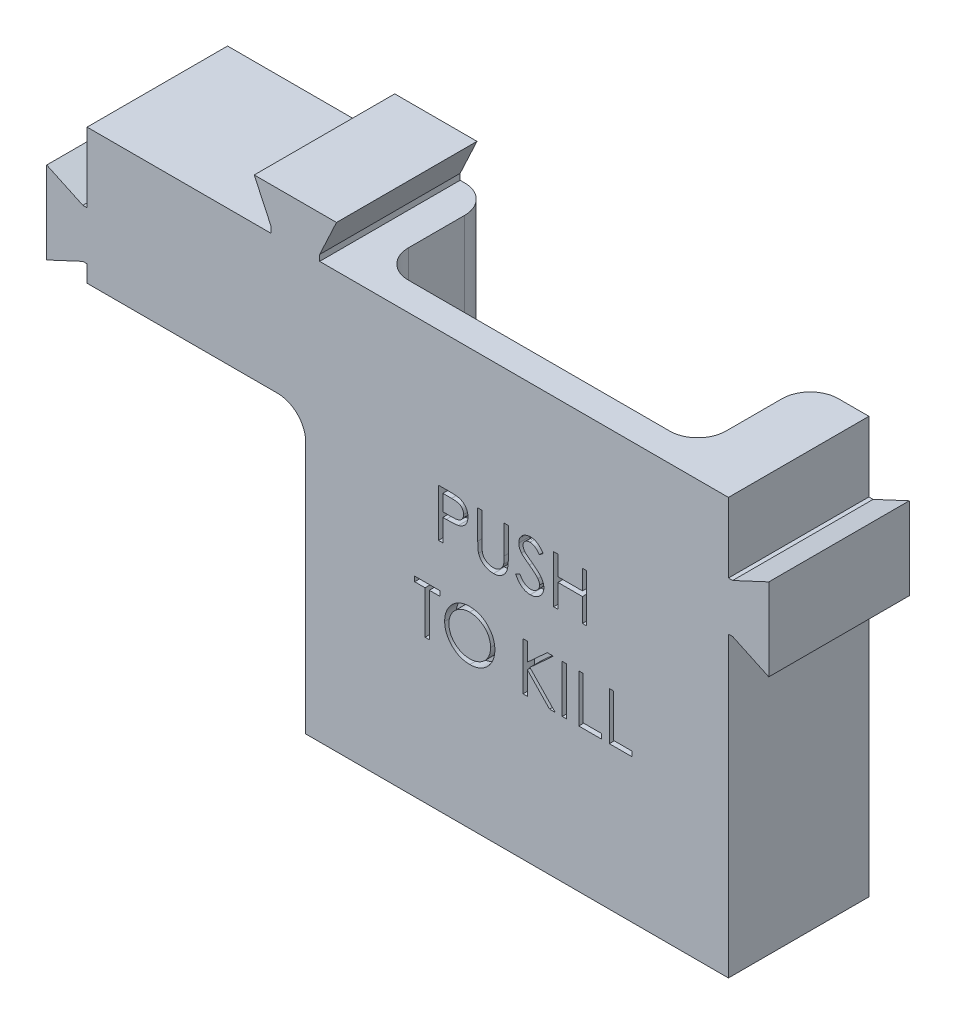
from build123d import *

# Parameters (mm, degrees)
BOSS_EXTRUDE1_DEPTH = 12.7
SKETCH2_W           = 28.702
SKETCH2_H           = 10.16
CUT_EXTRUDE1_DEPTH  = 69.772075122
FILLET1_R           = 2.54
BOSS_EXTRUDE2_DEPTH = 25.4
FILLET2_R           = 2.54
SKETCH4_W           = 0.387512821
SKETCH4_H           = 4.318
CUT_EXTRUDE2_DEPTH  = 1.016


with BuildPart() as part:
    # Sketch1 → Boss-Extrude1 (new body)
    with BuildSketch(Plane.XY):
        Polygon((4.029982442, 97.409), (20.665303267, 97.409), (20.665303267, 97.951017558), (19.141418027, 101.219), (26.578581973, 101.219), (25.054696733, 97.951017558), (25.054696733, 97.409), (62.010017558, 97.409), (62.010017558, 91.094696733), (62.391017558, 91.094696733), (65.659, 92.618581973), (65.659, 85.181418027), (62.391017558, 86.705303267), (62.010017558, 86.705303267), (62.010017558, 85.181418027), (4.029982442, 85.181418027), (4.029982442, 86.705303267), (3.648982442, 86.705303267), (0.381, 85.181418027), (0.381, 92.618581973), (3.648982442, 91.094696733), (4.029982442, 91.094696733), align=None)
    extrude(amount=BOSS_EXTRUDE1_DEPTH)

    # Sketch2 → Cut-Extrude1 (cut, through all)
    with BuildSketch(Plane.XZ.offset(-85.181418027)):
        with Locations((42.3545, 5.08)):
            Rectangle(SKETCH2_W, SKETCH2_H)
    extrude(amount=-CUT_EXTRUDE1_DEPTH, mode=Mode.SUBTRACT)

    # Fillet1
    fillet1_edges = [part.edges().sort_by_distance(p)[0] for p in [
        (56.7055, 91.295209014, 0),
        (28.0035, 91.295209014, 0),
        (28.0035, 91.295209014, 10.16),
        (56.7055, 91.295209014, 10.16),
    ]]
    fillet(fillet1_edges, radius=FILLET1_R)

    # Sketch3 → Boss-Extrude2 (add)
    with BuildSketch(Plane.XZ.offset(-85.181418027)):
        with BuildLine():
            Line((23.793902063, 12.7), (23.793902063, 0))
            Line((23.793902063, 0), (25.4635, 0))
            ThreePointArc((25.4635, 0), (27.259551224, 0.743948776), (28.0035, 2.54))
            Line((28.0035, 2.54), (28.0035, 7.62))
            ThreePointArc((28.0035, 7.62), (28.747448776, 9.416051224), (30.5435, 10.16))
            Line((30.5435, 10.16), (54.1655, 10.16))
            ThreePointArc((54.1655, 10.16), (55.961551224, 9.416051224), (56.7055, 7.62))
            Line((56.7055, 7.62), (56.7055, 2.54))
            ThreePointArc((56.7055, 2.54), (57.449448776, 0.743948776), (59.2455, 0))
            Line((59.2455, 0), (62.010017558, 0))
            Line((62.010017558, 0), (62.010017558, 12.7))
            Line((62.010017558, 12.7), (23.793902063, 12.7))
        make_face()
    extrude(amount=BOSS_EXTRUDE2_DEPTH)

    # Fillet2
    fillet2_edges = [part.edges().sort_by_distance(p)[0] for p in [
        (23.793902063, 85.181418027, 6.35),
    ]]
    fillet(fillet2_edges, radius=FILLET2_R)

    # Sketch4 → Cut-Extrude2 (cut)
    # profile 1 of 10: a face of its own
    with BuildSketch(Plane.XY.offset(12.7)):
        with BuildLine():
            Line((35.803091039, 85.260556175), (36.64991035, 85.260556175))
            add(Edge.make_bspline(
                [(36.64991035, 85.260556175), (36.708155119, 85.26049215), (36.819754684, 85.260369475), (36.979786001, 85.25665014), (37.12512955, 85.251682352), (37.255471934, 85.244795891), (37.371214195, 85.236657583), (37.4718326, 85.22524321), (37.55811803, 85.213325166), (37.609818615, 85.201208356), (37.633397129, 85.195682377)],
                knots=[0, 0, 0, 0, 1.415646017, 2.712440637, 3.8905458, 4.950247383, 5.884950622, 6.709939814, 7.411656543, 8, 8, 8, 8], degree=3))
            add(Edge.make_bspline(
                [(37.633397129, 85.195682377), (37.663245037, 85.187512783), (37.722237525, 85.171366101), (37.807241726, 85.139025856), (37.888116442, 85.100679345), (37.965139147, 85.056976324), (38.037363351, 85.006041734), (38.105866621, 84.949940282), (38.170044414, 84.887376695), (38.229535834, 84.819052685), (38.284170622, 84.746115238), (38.331211756, 84.667475538), (38.370600832, 84.584457296), (38.404383965, 84.497118256), (38.428698567, 84.404724994), (38.447015399, 84.30791949), (38.458641463, 84.20671212), (38.459754967, 84.137550261), (38.460321808, 84.102342633)],
                knots=[0, 0, 0, 0, 0.999701418, 1.975846123, 2.934577507, 3.890451536, 4.834027766, 5.787354733, 6.749476667, 7.726910423, 8.712836071, 9.690891519, 10.682875813, 11.679750201, 12.712814741, 13.765529915, 14.8625177, 16, 16, 16, 16], degree=3))
            add(Edge.make_bspline(
                [(38.460321808, 84.102342633), (38.45980189, 84.066839079), (38.458784636, 83.997373977), (38.446575448, 83.895749491), (38.4301298, 83.798633489), (38.404842294, 83.706241304), (38.371722403, 83.619121619), (38.332870208, 83.535943082), (38.286009384, 83.45812079), (38.232164134, 83.385372215), (38.172265338, 83.317629071), (38.106566428, 83.255382271), (38.035332638, 83.198996175), (37.958790353, 83.148344378), (37.876193368, 83.104601459), (37.788794391, 83.065422018), (37.695833753, 83.03251755), (37.631504789, 83.015208463), (37.59879777, 83.006407938)],
                knots=[0, 0, 0, 0, 1.121902311, 2.195077645, 3.232258892, 4.234102512, 5.217864754, 6.176164875, 7.132989551, 8.084763148, 9.034132444, 9.988522005, 10.94243251, 11.903244335, 12.886203696, 13.894208494, 14.929344452, 16, 16, 16, 16], degree=3))
            add(Edge.make_bspline(
                [(37.59879777, 83.006407938), (37.571745705, 83.000655151), (37.512459531, 82.988047586), (37.414820024, 82.973972809), (37.301138945, 82.961959392), (37.171571458, 82.952951875), (37.026233864, 82.945240706), (36.865047541, 82.939111497), (36.687696082, 82.935743638), (36.563990016, 82.93556994), (36.499403138, 82.935479252)],
                knots=[0, 0, 0, 0, 0.601384939, 1.31797006, 2.144135048, 3.087295005, 4.142315834, 5.309527816, 6.595305764, 8, 8, 8, 8], degree=3))
            Line((36.499403138, 82.935479252), (36.190603859, 82.935479252))
            Line((36.190603859, 82.935479252), (36.190603859, 80.942556175))
            Line((36.190603859, 80.942556175), (35.803091039, 80.942556175))
            Line((35.803091039, 80.942556175), (35.803091039, 85.260556175))
        make_face()
        with BuildLine():
            Line((36.190603859, 84.81768438), (36.190603859, 83.378351047))
            Line((36.190603859, 83.378351047), (36.946599853, 83.368836223))
            add(Edge.make_bspline(
                [(36.946599853, 83.368836223), (36.983512493, 83.368817145), (37.054771583, 83.368780316), (37.157708044, 83.373696944), (37.253208987, 83.379372686), (37.340981066, 83.387682891), (37.421063847, 83.399429403), (37.493590861, 83.411287541), (37.557999732, 83.428442786), (37.63337869, 83.451541704), (37.717374089, 83.490937428), (37.808752281, 83.548119949), (37.88619325, 83.621008663), (37.953206509, 83.702961627), (38.006386847, 83.794132039), (38.045317925, 83.891680516), (38.068192416, 83.994606646), (38.071259668, 84.065037098), (38.072808988, 84.100612665)],
                knots=[0, 0, 0, 0, 1.160613943, 2.240541288, 3.23993089, 4.169200891, 5.011653406, 5.7853311, 6.478053781, 7.106038997, 8.262395093, 9.384106736, 10.481365981, 11.59014053, 12.70357646, 13.786202915, 14.881775077, 16, 16, 16, 16], degree=3))
            add(Edge.make_bspline(
                [(38.072808988, 84.100612665), (38.071251243, 84.135327551), (38.068154638, 84.204336448), (38.045138633, 84.305474816), (38.006462537, 84.401995323), (37.952849516, 84.49202326), (37.88778203, 84.573681333), (37.812156155, 84.64461636), (37.726149908, 84.701640735), (37.646145719, 84.738446481), (37.575082313, 84.760918927), (37.51335717, 84.776642418), (37.443663818, 84.789196209), (37.365979568, 84.799361402), (37.280906537, 84.808063357), (37.187713839, 84.813967886), (37.086754504, 84.817424082), (37.016666492, 84.817595514), (36.980334228, 84.81768438)],
                knots=[0, 0, 0, 0, 1.120700087, 2.227813068, 3.331159281, 4.466773991, 5.599788987, 6.693661531, 7.80175334, 8.91857717, 9.525282508, 10.207424825, 10.974604443, 11.810962634, 12.737642355, 13.736264703, 14.826523623, 16, 16, 16, 16], degree=3))
            Line((36.980334228, 84.81768438), (36.190603859, 84.81768438))
        make_face(mode=Mode.SUBTRACT)
    # profile 2 of 10: a face of its own
    with BuildSketch(Plane.XY.offset(12.7)):
        with BuildLine():
            Line((39.346065398, 85.260556175), (39.733578218, 85.260556175))
            Line((39.733578218, 85.260556175), (39.733578218, 82.673389108))
            add(Edge.make_bspline(
                [(39.733578218, 82.673389108), (39.73352055, 82.63677156), (39.733411113, 82.567283453), (39.734142106, 82.468378675), (39.736189293, 82.380448824), (39.737479955, 82.303154962), (39.740351219, 82.236851767), (39.742692867, 82.181180026), (39.745703817, 82.13640335), (39.749322446, 82.110272139), (39.750877898, 82.099039749)],
                knots=[0, 0, 0, 0, 1.528628734, 2.90083645, 4.128790002, 5.200304208, 6.127813768, 6.898992206, 7.526736466, 8, 8, 8, 8], degree=3))
            add(Edge.make_bspline(
                [(39.750877898, 82.099039749), (39.757265403, 82.058516228), (39.7696805, 81.979752541), (39.801320802, 81.867597695), (39.845509365, 81.766517684), (39.897871953, 81.673358325), (39.966876815, 81.590712595), (40.049540033, 81.514578047), (40.149690206, 81.447992261), (40.261046005, 81.387107459), (40.381068192, 81.338172081), (40.503713291, 81.301168839), (40.627137744, 81.278617899), (40.709767196, 81.276006694), (40.750799372, 81.274710021)],
                knots=[0, 0, 0, 0, 1.035780045, 2.013197591, 2.933192213, 3.817615948, 4.702609284, 5.640816605, 6.646850145, 7.73207398, 8.84249596, 9.914020372, 10.964143139, 12, 12, 12, 12], degree=3))
            add(Edge.make_bspline(
                [(40.750799372, 81.274710021), (40.78602653, 81.276034846), (40.856277382, 81.278676843), (40.960657544, 81.29503766), (41.062315735, 81.324524129), (41.161753945, 81.362571579), (41.254962274, 81.412842465), (41.341992726, 81.470914432), (41.419672232, 81.539028878), (41.490558984, 81.614409246), (41.552287799, 81.699461262), (41.605795396, 81.792332976), (41.649624243, 81.894422028), (41.671267941, 81.966167969), (41.682387113, 82.003026528)],
                knots=[0, 0, 0, 0, 0.994687771, 1.983630487, 2.973142513, 3.978332533, 4.983357753, 5.956394766, 6.925816176, 7.893390482, 8.871859704, 9.88551698, 10.913711441, 12, 12, 12, 12], degree=3))
            add(Edge.make_bspline(
                [(41.682387113, 82.003026528), (41.68608841, 82.01826114), (41.694336392, 82.052209996), (41.702043461, 82.109603977), (41.710070654, 82.17732177), (41.715640344, 82.25584992), (41.721070192, 82.344925292), (41.724318652, 82.445011915), (41.725820123, 82.555746359), (41.726267567, 82.633022721), (41.726501295, 82.673389108)],
                knots=[0, 0, 0, 0, 0.558680831, 1.244966039, 2.062412453, 2.990489873, 4.051219941, 5.244515665, 6.560634259, 8, 8, 8, 8], degree=3))
            Line((41.726501295, 82.673389108), (41.726501295, 85.260556175))
            Line((41.726501295, 85.260556175), (42.114014116, 85.260556175))
            Line((42.114014116, 85.260556175), (42.114014116, 82.652629492))
            add(Edge.make_bspline(
                [(42.114014116, 82.652629492), (42.113700604, 82.605626978), (42.113088766, 82.513898713), (42.107783084, 82.379483865), (42.099323505, 82.251975816), (42.087371172, 82.131357425), (42.071533978, 82.018060311), (42.053922435, 81.9110914), (42.031494085, 81.811218536), (42.005298135, 81.717662999), (41.975351512, 81.6286067), (41.936562118, 81.544086643), (41.892858406, 81.461533393), (41.841024329, 81.38219556), (41.782778972, 81.305721864), (41.716834869, 81.232576085), (41.645373005, 81.161589342), (41.567205411, 81.094582536), (41.48362062, 81.03313286), (41.394867266, 80.979098924), (41.301627126, 80.933422358), (41.204142569, 80.895823775), (41.102371993, 80.867553707), (40.996312833, 80.846487843), (40.88572368, 80.83451798), (40.810510713, 80.83273905), (40.772423972, 80.831838226)],
                knots=[0, 0, 0, 0, 1.316592851, 2.569410997, 3.76748051, 4.895814652, 5.963796859, 6.97159953, 7.931736103, 8.829262218, 9.692595152, 10.560224239, 11.431080259, 12.30701507, 13.211635791, 14.121146779, 15.063487852, 16.031507147, 17.00238618, 17.966455255, 18.938106653, 19.907068911, 20.888905087, 21.893141452, 22.933117798, 24, 24, 24, 24], degree=3))
            add(Edge.make_bspline(
                [(40.772423972, 80.831838226), (40.730885919, 80.832806402), (40.649388408, 80.83470596), (40.529301043, 80.845590713), (40.414177986, 80.866093064), (40.302803347, 80.892198389), (40.196693436, 80.928202782), (40.094426609, 80.970270126), (39.997754385, 81.0219347), (39.905108452, 81.079417635), (39.818964653, 81.14409466), (39.739886771, 81.214589309), (39.667744254, 81.289772323), (39.603753102, 81.370457689), (39.546853108, 81.45601788), (39.497837376, 81.546694942), (39.45575138, 81.642453768), (39.434029906, 81.709016602), (39.423048972, 81.742666351)],
                knots=[0, 0, 0, 0, 1.13879206, 2.234305948, 3.301075583, 4.341971843, 5.366689343, 6.369221514, 7.369726634, 8.367512178, 9.355451585, 10.318319045, 11.268648973, 12.207971039, 13.137398894, 14.081662264, 15.030215811, 16, 16, 16, 16], degree=3))
            add(Edge.make_bspline(
                [(39.423048972, 81.742666351), (39.416661838, 81.765653625), (39.402808002, 81.815513532), (39.38797222, 81.898032349), (39.375500502, 81.993046753), (39.363773359, 82.100563248), (39.356853507, 82.220665169), (39.350786793, 82.353300455), (39.346022659, 82.498629483), (39.346050753, 82.599861311), (39.346065398, 82.652629492)],
                knots=[0, 0, 0, 0, 0.625038921, 1.35572334, 2.194682327, 3.136881307, 4.189498639, 5.346923369, 6.617055217, 8, 8, 8, 8], degree=3))
            Line((39.346065398, 82.652629492), (39.346065398, 85.260556175))
        make_face()
    # profile 3 of 10: a face of its own
    with BuildSketch(Plane.XY.offset(12.7)):
        with BuildLine():
            Line((42.778321808, 81.775535742), (43.143345045, 81.994376688))
            add(Edge.make_bspline(
                [(43.143345045, 81.994376688), (43.177294688, 81.937546398), (43.242340892, 81.828661756), (43.350847741, 81.681531408), (43.463279715, 81.556479467), (43.580469413, 81.454233412), (43.701701517, 81.373734929), (43.827767444, 81.316734575), (43.958242366, 81.281183895), (44.047037497, 81.276865788), (44.091367481, 81.274710021)],
                knots=[0, 0, 0, 0, 1.272034388, 2.437168799, 3.508375237, 4.49857839, 5.41946034, 6.295179144, 7.148887113, 8, 8, 8, 8], degree=3))
            add(Edge.make_bspline(
                [(44.091367481, 81.274710021), (44.129226299, 81.275764443), (44.204281495, 81.277854836), (44.314775714, 81.297940694), (44.422086406, 81.328798515), (44.524001863, 81.37299131), (44.619115824, 81.426458619), (44.702523169, 81.491038846), (44.774628974, 81.563342159), (44.833611762, 81.644005674), (44.878864445, 81.730756945), (44.913645403, 81.819801447), (44.932946954, 81.912537984), (44.935854514, 81.974976835), (44.937321808, 82.006486463)],
                knots=[0, 0, 0, 0, 1.095163259, 2.171163733, 3.241058638, 4.321873601, 5.38011039, 6.391990106, 7.366004449, 8.327778327, 9.272591725, 10.192022065, 11.087607919, 12, 12, 12, 12], degree=3))
            add(Edge.make_bspline(
                [(44.937321808, 82.006486463), (44.93550293, 82.042437946), (44.931805416, 82.115522057), (44.900553608, 82.223348257), (44.851391023, 82.330055376), (44.806036424, 82.396060652), (44.782489677, 82.430328611)],
                knots=[0, 0, 0, 0, 0.938893495, 1.908633276, 2.914225137, 4, 4, 4, 4], degree=3))
            add(Edge.make_bspline(
                [(44.782489677, 82.430328611), (44.763156616, 82.455060664), (44.722569274, 82.506982514), (44.652793463, 82.584268836), (44.570916639, 82.663989503), (44.479740768, 82.749188648), (44.375944574, 82.835903707), (44.262779029, 82.928269771), (44.137354874, 83.022774231), (44.049391667, 83.086153299), (44.0040041, 83.118855854)],
                knots=[0, 0, 0, 0, 0.722233717, 1.516239348, 2.393582979, 3.351407094, 4.387010283, 5.505090956, 6.712668013, 8, 8, 8, 8], degree=3))
            add(Edge.make_bspline(
                [(44.0040041, 83.118855854), (43.95857381, 83.151214438), (43.871714554, 83.213081585), (43.750244795, 83.304899887), (43.641623083, 83.388846581), (43.546332205, 83.465711931), (43.464414074, 83.535506362), (43.395223168, 83.597559648), (43.340522057, 83.653549995), (43.310104115, 83.689872199), (43.296447209, 83.706179973)],
                knots=[0, 0, 0, 0, 1.452282411, 2.77665338, 3.964542531, 5.026858415, 5.96415736, 6.766646006, 7.446254459, 8, 8, 8, 8], degree=3))
            add(Edge.make_bspline(
                [(43.296447209, 83.706179973), (43.277358509, 83.731595767), (43.239818018, 83.781579335), (43.190264643, 83.859704117), (43.148146671, 83.939677506), (43.115129599, 84.021714404), (43.087326344, 84.104663096), (43.068625788, 84.189605861), (43.056916116, 84.276161551), (43.055716963, 84.334409521), (43.05511668, 84.363567794)],
                knots=[0, 0, 0, 0, 1.068054152, 2.10047183, 3.106115577, 4.101338837, 5.06977816, 6.043150881, 7.020423561, 8, 8, 8, 8], degree=3))
            add(Edge.make_bspline(
                [(43.05511668, 84.363567794), (43.056726935, 84.409251955), (43.059913027, 84.499643812), (43.086857985, 84.631689277), (43.129387686, 84.75775812), (43.188969779, 84.876602228), (43.265777565, 84.985127116), (43.354661713, 85.084581126), (43.460528569, 85.168188194), (43.576686006, 85.241238957), (43.703828124, 85.298416587), (43.837058044, 85.341548447), (43.976587518, 85.365987412), (44.071093899, 85.369494571), (44.119046968, 85.371274124)],
                knots=[0, 0, 0, 0, 1.005424448, 1.989358655, 2.955360095, 3.929531133, 4.905563448, 5.876582895, 6.856512386, 7.866279853, 8.892233794, 9.918561126, 10.94386622, 12, 12, 12, 12], degree=3))
            add(Edge.make_bspline(
                [(44.119046968, 85.371274124), (44.169930404, 85.369519101), (44.271121318, 85.366028922), (44.419967978, 85.335682597), (44.563277114, 85.285469596), (44.678559404, 85.228485989), (44.768784337, 85.171573003), (44.837591954, 85.119732545), (44.90731834, 85.060051483), (44.978525929, 84.992370847), (45.050008148, 84.916069627), (45.122826225, 84.831670382), (45.19715044, 84.739688894), (45.244964098, 84.674025067), (45.269475654, 84.640362665)],
                knots=[0, 0, 0, 0, 1.286793592, 2.559021753, 3.825965368, 5.121522368, 5.803751409, 6.523245864, 7.299691795, 8.125521123, 9.008227632, 9.944561021, 10.946284179, 12, 12, 12, 12], degree=3))
            Line((45.269475654, 84.640362665), (44.919157145, 84.374812585))
            add(Edge.make_bspline(
                [(44.919157145, 84.374812585), (44.898003963, 84.402063718), (44.85726788, 84.454543029), (44.795422416, 84.528037012), (44.737131084, 84.5951714), (44.679701191, 84.653483064), (44.626165848, 84.706165295), (44.574205452, 84.75126959), (44.524567758, 84.789237882), (44.46199758, 84.829757451), (44.383388121, 84.869922874), (44.284710056, 84.903910565), (44.181588474, 84.924334782), (44.111353575, 84.927035244), (44.07579777, 84.928402329)],
                knots=[0, 0, 0, 0, 1.181633172, 2.275549214, 3.290209073, 4.226197932, 5.078386478, 5.862611352, 6.581680152, 7.217281963, 8.414376989, 9.595101626, 10.782541182, 12, 12, 12, 12], degree=3))
            add(Edge.make_bspline(
                [(44.07579777, 84.928402329), (44.031190951, 84.926907437), (43.945170905, 84.92402468), (43.823045236, 84.892540309), (43.713128788, 84.842967374), (43.618684795, 84.773490781), (43.540051576, 84.691176139), (43.483170613, 84.596452969), (43.448934838, 84.491855708), (43.444757137, 84.418891802), (43.4426295, 84.381732457)],
                knots=[0, 0, 0, 0, 1.14458467, 2.207223713, 3.21896685, 4.227309161, 5.202851033, 6.127160689, 7.046193047, 8, 8, 8, 8], degree=3))
            add(Edge.make_bspline(
                [(43.4426295, 84.381732457), (43.443114506, 84.35859849), (43.444085311, 84.312292728), (43.457625076, 84.243881516), (43.47501962, 84.175643127), (43.502584044, 84.107884352), (43.540638335, 84.039420168), (43.590610149, 83.969071636), (43.653546001, 83.896218699), (43.70175587, 83.848834973), (43.727209228, 83.823817794)],
                knots=[0, 0, 0, 0, 0.858281714, 1.717966888, 2.583508476, 3.4729293, 4.427298488, 5.488583878, 6.674047936, 8, 8, 8, 8], degree=3))
            add(Edge.make_bspline(
                [(43.727209228, 83.823817794), (43.736661173, 83.815382857), (43.759116829, 83.795343379), (43.800169814, 83.762536102), (43.854382672, 83.722066854), (43.920339754, 83.671993702), (43.999257202, 83.613908629), (44.091143694, 83.548554327), (44.194974979, 83.473809181), (44.26865476, 83.421552078), (44.307613475, 83.393920758)],
                knots=[0, 0, 0, 0, 0.420754252, 0.999615792, 1.744751191, 2.668019286, 3.750313428, 4.999500688, 6.413464383, 8, 8, 8, 8], degree=3))
            add(Edge.make_bspline(
                [(44.307613475, 83.393920758), (44.354477239, 83.359819218), (44.445222422, 83.293786312), (44.574339974, 83.194576339), (44.69141182, 83.097547463), (44.796848996, 83.003319318), (44.891693136, 82.912606659), (44.974892015, 82.824318142), (45.047293377, 82.739086284), (45.125238482, 82.629813032), (45.204884386, 82.495608254), (45.273283366, 82.331180987), (45.316411978, 82.166114555), (45.322051922, 82.055170532), (45.324834629, 82.000431576)],
                knots=[0, 0, 0, 0, 1.163667725, 2.253281268, 3.268753668, 4.215851969, 5.092017293, 5.902905408, 6.650798638, 7.335211899, 8.59617414, 9.77448103, 10.901945474, 12, 12, 12, 12], degree=3))
            add(Edge.make_bspline(
                [(45.324834629, 82.000431576), (45.324023908, 81.961719638), (45.32241821, 81.885047523), (45.303960717, 81.772464831), (45.276918113, 81.663119661), (45.236159606, 81.558363609), (45.186412349, 81.456280213), (45.123287818, 81.359547266), (45.05011908, 81.266023829), (44.966184853, 81.178203739), (44.87433988, 81.097585204), (44.777266681, 81.02587055), (44.674806373, 80.966074487), (44.567514786, 80.917280048), (44.455367275, 80.879116926), (44.338401557, 80.851465849), (44.216424829, 80.834495232), (44.133518635, 80.832733782), (44.091367481, 80.831838226)],
                knots=[0, 0, 0, 0, 0.983748083, 1.948392443, 2.894712957, 3.844097841, 4.80183111, 5.778335162, 6.776009319, 7.81870978, 8.863265674, 9.881300176, 10.883814829, 11.87499822, 12.874611388, 13.892143829, 14.928324115, 16, 16, 16, 16], degree=3))
            add(Edge.make_bspline(
                [(44.091367481, 80.831838226), (44.058753821, 80.832468878), (43.993937236, 80.83372224), (43.898065938, 80.844802574), (43.804131439, 80.860479509), (43.713312448, 80.885368548), (43.624438864, 80.915566144), (43.537897218, 80.952748235), (43.45364557, 80.997306543), (43.371211763, 81.048252804), (43.290805453, 81.10754233), (43.213180807, 81.176597633), (43.135790914, 81.253514173), (43.060920006, 81.340380691), (42.987053653, 81.435793788), (42.915648232, 81.540646158), (42.845225702, 81.654366676), (42.801039647, 81.734391659), (42.778321808, 81.775535742)],
                knots=[0, 0, 0, 0, 0.915332311, 1.819136955, 2.706846663, 3.586547465, 4.459518054, 5.340707479, 6.227863349, 7.133153174, 8.059268498, 9.028702269, 10.047606654, 11.120612155, 12.245963614, 13.433783089, 14.680604001, 16, 16, 16, 16], degree=3))
        make_face()
    # profile 4 of 10: a face of its own
    with BuildSketch(Plane.XY.offset(12.7)):
        Polygon((46.210578218, 85.260556175), (46.598091039, 85.260556175), (46.598091039, 83.489068996), (48.812450013, 83.489068996), (48.812450013, 85.260556175), (49.199962834, 85.260556175), (49.199962834, 80.942556175), (48.812450013, 80.942556175), (48.812450013, 83.046197201), (46.598091039, 83.046197201), (46.598091039, 80.942556175), (46.210578218, 80.942556175), align=None)
    # profile 5 of 10: a face of its own
    with BuildSketch(Plane.XY.offset(12.7)):
        Polygon((33.644091039, 76.621017713), (33.644091039, 77.063889508), (35.913808988, 77.063889508), (35.913808988, 76.621017713), (34.972706424, 76.621017713), (34.972706424, 72.745889508), (34.585193603, 72.745889508), (34.585193603, 76.621017713), align=None)
    # profile 6 of 10: a face of its own
    with BuildSketch(Plane.XY.offset(12.7)):
        with BuildLine():
            add(Edge.make_bspline(
                [(38.598719244, 77.174607457), (38.67867393, 77.17258234), (38.83571153, 77.168604845), (39.066508504, 77.138157882), (39.286843824, 77.085483969), (39.498512356, 77.015331296), (39.698982262, 76.921748657), (39.889762473, 76.808635379), (40.070399062, 76.674806423), (40.238457326, 76.521296308), (40.392248387, 76.354271807), (40.527742152, 76.176027345), (40.641296044, 75.987640651), (40.73454731, 75.789677832), (40.807704852, 75.582586592), (40.85818726, 75.365262882), (40.89043427, 75.1391148), (40.894204226, 74.984867371), (40.89611668, 74.906619476)],
                knots=[0, 0, 0, 0, 1.065120563, 2.091984664, 3.0946048, 4.079830382, 5.057816894, 6.036188127, 7.030412546, 8.04752943, 9.064399622, 10.05169764, 11.02544977, 11.989514704, 12.962713494, 13.945757189, 14.957906945, 16, 16, 16, 16], degree=3))
            add(Edge.make_bspline(
                [(40.89611668, 74.906619476), (40.894204506, 74.828947975), (40.89043539, 74.675848449), (40.858150595, 74.45113548), (40.807517727, 74.235123586), (40.735226676, 74.028173378), (40.642419929, 73.830066543), (40.528109921, 73.641324353), (40.39346085, 73.46188493), (40.240225083, 73.293714048), (40.073178884, 73.139502882), (39.894006229, 73.005128109), (39.706736641, 72.889499318), (39.508960264, 72.797237631), (39.303300047, 72.723496159), (39.087915341, 72.673219057), (38.863815393, 72.640788356), (38.710993966, 72.63706437), (38.633318603, 72.63517156)],
                knots=[0, 0, 0, 0, 1.043624062, 2.057103931, 3.04512605, 4.022047818, 4.998200453, 5.980619268, 6.982898556, 8.009068085, 9.034988726, 10.034168286, 11.015286542, 11.987931943, 12.962482838, 13.94673481, 14.956375938, 16, 16, 16, 16], degree=3))
            add(Edge.make_bspline(
                [(38.633318603, 72.63517156), (38.555071115, 72.63708306), (38.400824486, 72.640851137), (38.174392223, 72.67315151), (37.956915853, 72.723661382), (37.74901729, 72.795845309), (37.550580603, 72.889135367), (37.361217695, 73.002889226), (37.181688644, 73.137866379), (37.013481884, 73.291052456), (36.859577016, 73.457815531), (36.72539902, 73.63649962), (36.611619581, 73.823599124), (36.518642761, 74.019633269), (36.445033865, 74.223654381), (36.394815749, 74.437023388), (36.362324709, 74.658523841), (36.358580575, 74.809336651), (36.356680783, 74.885859861)],
                knots=[0, 0, 0, 0, 1.053102029, 2.075944431, 3.073151272, 4.055350789, 5.033113405, 6.020478099, 7.024410459, 8.052272461, 9.079885166, 10.07527673, 11.055994387, 12.023226415, 12.992069828, 13.970394897, 14.97016774, 16, 16, 16, 16], degree=3))
            add(Edge.make_bspline(
                [(36.356680783, 74.885859861), (36.35734037, 74.93722268), (36.358651224, 75.039300352), (36.374432518, 75.190882632), (36.397332354, 75.340027163), (36.430151513, 75.486309836), (36.47307449, 75.629372559), (36.523720962, 75.770201986), (36.585579206, 75.907370934), (36.655506931, 76.04152921), (36.733553927, 76.170585478), (36.819760638, 76.292574632), (36.911099129, 76.40852033), (37.011231568, 76.515417977), (37.116857799, 76.616377328), (37.229691307, 76.709846874), (37.349043596, 76.796669457), (37.475428223, 76.874912037), (37.605730998, 76.945676821), (37.740053834, 77.006402522), (37.876572427, 77.058522091), (38.01592619, 77.100765487), (38.157745067, 77.134115296), (38.302338583, 77.156824711), (38.449591545, 77.172646255), (38.548796138, 77.17395091), (38.598719244, 77.174607457)],
                knots=[0, 0, 0, 0, 1.037015668, 2.060948919, 3.074880161, 4.083647147, 5.086022904, 6.090072063, 7.104153813, 8.122640571, 9.144368836, 10.147691507, 11.138137339, 12.123020368, 13.103399296, 14.087645067, 15.080126199, 16.082011238, 17.087798457, 18.072939717, 19.057185487, 20.037253025, 21.01195951, 21.997135196, 22.992090687, 24, 24, 24, 24], degree=3))
        make_face()
        with BuildLine():
            add(Edge.make_bspline(
                [(38.617748892, 76.731735662), (38.576771524, 76.731236143), (38.495208534, 76.730241881), (38.373953498, 76.717145121), (38.254293163, 76.698479161), (38.136202819, 76.67185373), (38.020176568, 76.63557753), (37.905132907, 76.593827519), (37.792120911, 76.54297247), (37.681513666, 76.485515059), (37.574285296, 76.421918419), (37.473105054, 76.351631537), (37.377711004, 76.276302726), (37.288336711, 76.195756188), (37.205244608, 76.109581737), (37.126799253, 76.019085788), (37.056144952, 75.921681713), (36.991392746, 75.820010816), (36.933447851, 75.714205528), (36.881921336, 75.605379761), (36.83977271, 75.492645804), (36.805398499, 75.377226703), (36.776899932, 75.259305257), (36.758845851, 75.137986915), (36.745605185, 75.013881289), (36.744667753, 74.930011104), (36.744193603, 74.887589829)],
                knots=[0, 0, 0, 0, 1.008559885, 2.007477868, 2.99961109, 3.989939068, 4.984837346, 5.991145699, 7.001802488, 8.033829008, 9.059044045, 10.069351652, 11.065060232, 12.050310815, 13.029377138, 14.011219647, 14.996725999, 15.989392538, 16.977580475, 17.965360261, 18.951710183, 19.937753436, 20.929683414, 21.935841486, 22.955955122, 24, 24, 24, 24], degree=3))
            add(Edge.make_bspline(
                [(36.744193603, 74.887589829), (36.745766418, 74.825210495), (36.748860633, 74.702491047), (36.775950001, 74.522654805), (36.817676654, 74.349825885), (36.879186399, 74.184949953), (36.956109243, 74.026609777), (37.051138418, 73.876210007), (37.163726056, 73.733709993), (37.291617229, 73.600104573), (37.431425071, 73.478157092), (37.579881279, 73.371115836), (37.735395416, 73.280548562), (37.898373024, 73.206766189), (38.067944016, 73.148300793), (38.245201064, 73.108231442), (38.428963374, 73.081860237), (38.554223193, 73.079327723), (38.617748892, 73.078043354)],
                knots=[0, 0, 0, 0, 1.032063989, 2.030389145, 3.003944642, 3.970395727, 4.937377036, 5.913328081, 6.909231446, 7.93887556, 8.970685674, 9.976071282, 10.964166581, 11.944589148, 12.933237628, 13.927779006, 14.949070134, 16, 16, 16, 16], degree=3))
            add(Edge.make_bspline(
                [(38.617748892, 73.078043354), (38.660447128, 73.078629991), (38.745130555, 73.079793467), (38.87108726, 73.091512121), (38.99477478, 73.110303896), (39.116019631, 73.137360059), (39.234684207, 73.171222069), (39.351263795, 73.211450689), (39.464516657, 73.261639671), (39.575871509, 73.317092601), (39.682459786, 73.380308316), (39.784211029, 73.448209667), (39.878560538, 73.523427526), (39.967867969, 73.60277733), (40.051301215, 73.687859014), (40.12829607, 73.778561962), (40.198593274, 73.875458693), (40.263320891, 73.976975373), (40.321062745, 74.083070179), (40.371372502, 74.192290507), (40.414054225, 74.304367416), (40.44851002, 74.419462561), (40.475510427, 74.537357345), (40.494114739, 74.658209626), (40.507128499, 74.781777637), (40.508109397, 74.8653542), (40.508603859, 74.90748446)],
                knots=[0, 0, 0, 0, 1.047197238, 2.076906641, 3.100256066, 4.114471768, 5.12198147, 6.126382909, 7.136867548, 8.15857795, 9.17633901, 10.174870724, 11.156907918, 12.133735059, 13.104061851, 14.077631395, 15.04955518, 16.038496417, 17.029181396, 18.010275684, 18.986308667, 19.968651475, 20.955262928, 21.950658345, 22.966943676, 24, 24, 24, 24], degree=3))
            add(Edge.make_bspline(
                [(40.508603859, 74.90748446), (40.508109001, 74.949326502), (40.507127357, 75.032327901), (40.494120955, 75.155034133), (40.475490771, 75.275016809), (40.448641808, 75.391804895), (40.414035932, 75.505428161), (40.371365049, 75.615779892), (40.321047642, 75.723271191), (40.263299667, 75.827636384), (40.198386774, 75.927782817), (40.127455304, 76.023522022), (40.049280569, 76.11305605), (39.966096119, 76.198595253), (39.875824153, 76.278315266), (39.778873586, 76.352242536), (39.676421415, 76.422161164), (39.567944328, 76.4852355), (39.455992216, 76.543484373), (39.341116196, 76.593389354), (39.224617667, 76.635794729), (39.106792879, 76.671963487), (38.986650108, 76.69837488), (38.865001155, 76.717161943), (38.742014327, 76.730237323), (38.659302149, 76.731234631), (38.617748892, 76.731735662)],
                knots=[0, 0, 0, 0, 1.02996197, 2.043119294, 3.035359645, 4.018872909, 4.991431989, 5.957985074, 6.929999688, 7.912076566, 8.892894881, 9.867085534, 10.843653904, 11.817741046, 12.803660682, 13.806313499, 14.818574707, 15.856120519, 16.894564902, 17.924820532, 18.937903209, 19.946497019, 20.957711757, 21.963978472, 22.977135795, 24, 24, 24, 24], degree=3))
        make_face(mode=Mode.SUBTRACT)
    # profile 7 of 10: a face of its own
    with BuildSketch(Plane.XY.offset(12.7)):
        Polygon((43.4426295, 77.063889508), (43.830142321, 77.063889508), (43.830142321, 75.419554973), (45.630173972, 77.063889508), (46.182898731, 77.063889508), (44.061093042, 75.126325406), (46.348975654, 72.745889508), (45.832580222, 72.745889508), (43.830142321, 74.829635903), (43.830142321, 72.745889508), (43.4426295, 72.745889508), align=None)
    # profile 8 of 10: a face of its own
    with BuildSketch(Plane.XY.offset(12.7)):
        with Locations((47.17936027, 74.904889508)):
            Rectangle(SKETCH4_W, SKETCH4_H)
    # profile 9 of 10: a face of its own
    with BuildSketch(Plane.XY.offset(12.7)):
        Polygon((48.480296167, 77.063889508), (48.867808988, 77.063889508), (48.867808988, 73.188761303), (50.528578218, 73.188761303), (50.528578218, 72.745889508), (48.480296167, 72.745889508), align=None)
    # profile 10 of 10: a face of its own
    with BuildSketch(Plane.XY.offset(12.7)):
        Polygon((51.248244885, 77.063889508), (51.635757706, 77.063889508), (51.635757706, 73.188761303), (53.296526936, 73.188761303), (53.296526936, 72.745889508), (51.248244885, 72.745889508), align=None)
    extrude(amount=-CUT_EXTRUDE2_DEPTH, mode=Mode.SUBTRACT)


solid = part.part
